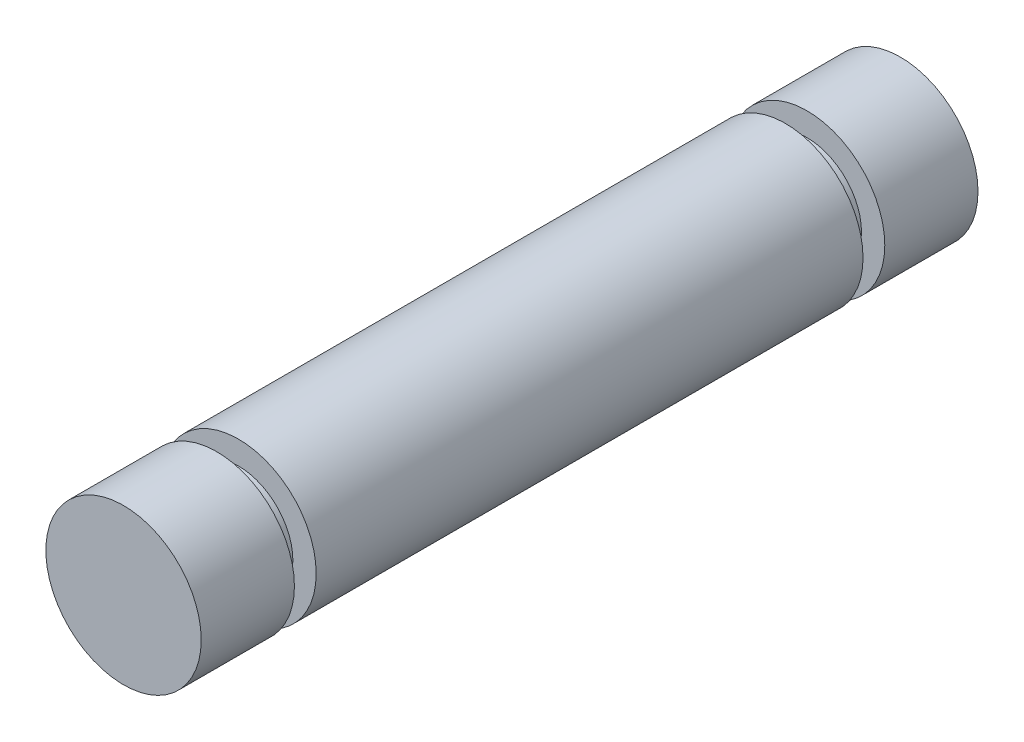
from build123d import *

# Parameters (mm, degrees)
SKETCH1_R           = 3.175
BOSS_EXTRUDE1_DEPTH = 15.875
SKETCH2_W           = 0.9525
SKETCH2_H           = 0.889


with BuildPart() as part:
    # Sketch1 → Boss-Extrude1 (new, symmetric)
    with BuildSketch(Plane.XY):
        Circle(SKETCH1_R)
    extrude(amount=BOSS_EXTRUDE1_DEPTH, both=True)

    # Sketch2 → Cut-Revolve1 (revolve, cut)
    with BuildSketch(Plane(origin=(0, 0, 0), x_dir=(1, 0, 0), z_dir=(0, 1, 0))):
        with Locations((2.69875, 11.6205)):
            Rectangle(SKETCH2_W, SKETCH2_H)
        with Locations((2.69875, -11.6205)):
            Rectangle(SKETCH2_W, SKETCH2_H)
    revolve(axis=Axis((0, 0, 15.875), (0, 0, -1)), mode=Mode.SUBTRACT)


solid = part.part
